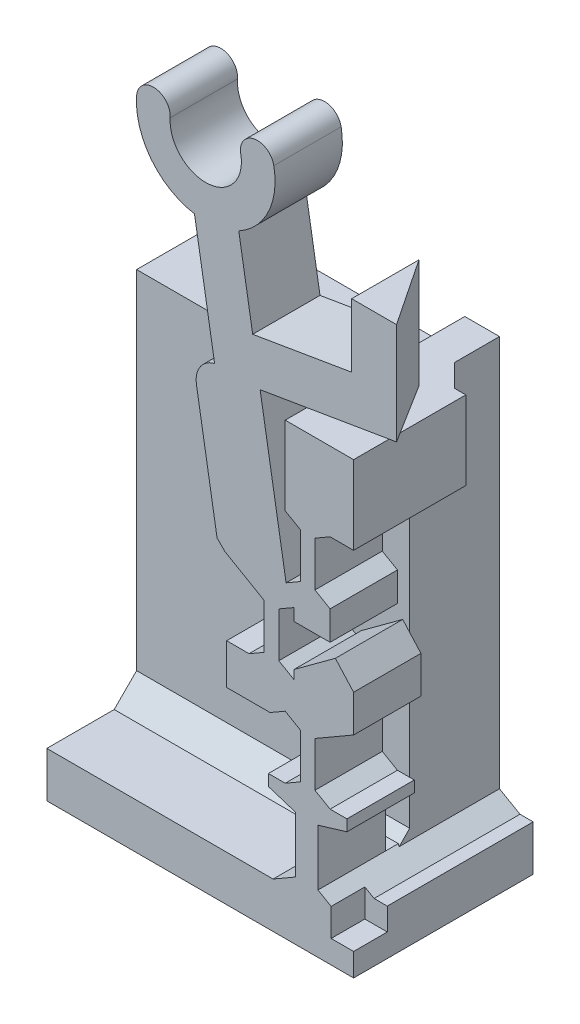
from build123d import *

# Parameters (mm, degrees)
BOSS_SWITCHMAIN_DEPTH                          = 3
SKETCH1_W                                      = 4
SKETCH1_H                                      = 3.5
BOSS_FLANGE_WIDTH_DEPTH                        = 5
BOSS_FLANGE_HEIGHT_REACH                       = 38.958
SKETCH2_W                                      = 4
SKETCH2_H                                      = 2
SKETCH2_W_2                                    = 8
SKETCH2_H_2                                    = 2.024994097
CUT_UP_TO_DOWN_DERAILLEUR_CLEARANCE_REACH      = 27.678
SKETCH10_W                                     = 2.453096586
SKETCH10_H                                     = 3
SKETCH17_W                                     = 12.1675
SKETCH17_H                                     = 4
BOSS_FLANGE_SUPPORT_DEPTH                      = 14.475002167
TAP_DRILL_FOR_M2X0_4_TAP1_D                    = 1.6
M2_CLEARANCE_HOLE2_D                           = 2.4
M2_CLEARANCE_HOLE2_DEPTH                       = 15
M2_CLEARANCE_HOLE2_TIP                         = 0.721032743
CUT_UP_TO_DOWN_CANTILEVER_SLOPE_REACH          = 32.725
CUT_DOWN_TO_UP_DERAILLEUR_CLEARANCE_DEPTH      = 34.178566414
CUT_DOWN_TO_UP_DERAILLEUR_CLEARANCE_DEPTH_BACK = 34.178566414
CHAMFER_FLANGE_SUPPORT_SIZE                    = 1.5
CHAMFER_FLANGE_SUPPORT_2_SIZE                  = 1
CHAMFER_FLANGE_SUPPORT_3_SIZE                  = 1
SKETCH18_W                                     = 1.5
SKETCH18_H                                     = 1.577350269
CUT_DOWN_TO_UP_DERAILLEUR_CLEARANCE_2_DEPTH    = 1


with BuildPart() as part:
    # Sketch-SwitchBossUp → Boss-SwitchMain (new body)
    with BuildSketch(Plane.XY):
        with BuildLine():
            Line((6.540476927, 22.165014537), (6.540476927, 25.000549624))
            Line((6.540476927, 25.000549624), (8.540476927, 25.000549624))
            Line((8.540476927, 25.000549624), (8.540476927, 20.473554675))
            Line((8.540476927, 20.473554675), (2.463355023, 19.450530066))
            Line((2.463355023, 19.450530066), (3.620297651, 12.577888564))
            Line((3.620297651, 12.577888564), (4.256080915, 12.944958203))
            Line((4.256080915, 12.944958203), (4.256080915, 14.944958203))
            Line((4.256080915, 14.944958203), (3.581073513, 15.334673908))
            Line((3.581073513, 15.334673908), (3.581073513, 18.834673908))
            Line((3.581073513, 18.834673908), (6.857327822, 18.834673908))
            Line((6.857327822, 18.834673908), (15.309115797, 18.834673908))
            Line((15.309115797, 18.834673908), (15.309115797, -1.165326092))
            Line((15.309115797, -1.165326092), (5.040476927, -1.165326092))
            Line((5.040476927, -1.165326092), (3.040476927, -1.165326092))
            Line((3.040476927, -1.165326092), (3.040476927, 0.859668005))
            Line((3.040476927, 0.859668005), (4.040476927, 1.437018274))
            Line((4.040476927, 1.437018274), (4.040476927, 3.937018274))
            Line((4.040476927, 3.937018274), (2.83114552, 4.326720436))
            Line((2.83114552, 4.326720436), (2.83114552, 4.826720436))
            Line((2.83114552, 4.826720436), (3.58114552, 4.826720436))
            Line((3.58114552, 4.826720436), (4.256138119, 5.216427595))
            Line((4.256138119, 5.216427595), (4.256138119, 7.216427595))
            Line((4.256138119, 7.216427595), (3.581130717, 7.6061433))
            Line((3.581130717, 7.6061433), (2.9061262, 7.216422599))
            Line((2.9061262, 7.216422599), (0.971281627, 7.216422599))
            Line((0.971281627, 7.216422599), (0.971281627, 9.019692757))
            Line((0.971281627, 9.019692757), (1.971281627, 9.019692757))
            Line((1.971281627, 9.019692757), (2.646271341, 9.40939825))
            Line((2.646271341, 9.40939825), (2.646271341, 11.40939825))
            Line((2.646271341, 11.40939825), (0.897326855, 12.41915182))
            Line((0.897326855, 12.41915182), (0.545466745, 12.771663724))
            Line((0.545466745, 12.771663724), (-0.372784255, 18.226393961))
            ThreePointArc((-0.372784255, 18.226393961), (-0.209313172, 18.996084896), (0.435897335, 19.446473985))
            Line((0.435897335, 19.446473985), (-0.46073685, 24.772792819))
            ThreePointArc((-0.46073685, 24.772792819), (-2.387846783, 25.912534906), (-3.038018253, 28.054973186))
            ThreePointArc((-3.038018253, 28.054973186), (-2.23296648, 28.745546602), (-1.542393064, 27.940494829))
            ThreePointArc((-1.542393064, 27.940494829), (0.129544452, 26.234339128), (1.59980805, 28.11706781))
            ThreePointArc((1.59980805, 28.11706781), (2.195840434, 28.994419163), (3.073191787, 28.398386779))
            ThreePointArc((3.073191787, 28.398386779), (2.830256228, 26.496543155), (1.511513111, 25.104801997))
            Line((1.511513111, 25.104801997), (2.131345845, 21.422780026))
            Line((2.131345845, 21.422780026), (6.540476927, 22.165014537))
        make_face()
        Polygon((5.581091201, 12.555245643), (5.581100766, 11.263016278), (3.971265023, 11.263016278), (3.97126394, 11.79911022), (3.296271341, 11.409403061), (3.296271341, 9.409403061), (3.971278743, 9.019687356), (3.971278743, 9.409408058), (5.815189335, 10.763016278), (6.627976927, 9.860324206), (6.627976927, 8.210536506), (5.581127833, 7.606137899), (4.906138119, 7.216432406), (4.906138119, 5.216432406), (5.58114552, 4.826716701), (6.33114552, 4.826716701), (6.33114552, 4.326716701), (5.040476927, 3.937018274), (5.040476927, 1.437018274), (6.040476927, 0.859668005), (9.127976927, 0.859668005), (10.437466736, 2.169157813), (10.437466736, 14.025180364), (9.127976927, 15.334670172), (5.581073513, 15.334670172), (4.906080915, 14.944963014), (4.906080915, 12.944963014), align=None, mode=Mode.SUBTRACT)
    extrude(amount=BOSS_SWITCHMAIN_DEPTH)

    # Sketch1 → Boss-Flange Width (add)
    with BuildSketch(Plane(origin=(0, 0, 0), x_dir=(-1, 0, 0), z_dir=(0, 0, -1))):
        Polygon((-7.581073513, -1.165326092), (0.412170615, -1.165326092), (0.412170615, 0.859668005), (-3.040476927, 0.859668005), (-4.040476927, 1.437018274), (-5.040476927, 1.437018274), (-6.040476927, 0.859668005), (-7.581073513, 0.859668005), align=None)
        with Locations((-5.581073513, 17.084673908)):
            Rectangle(SKETCH1_W, SKETCH1_H)
    extrude(amount=BOSS_FLANGE_WIDTH_DEPTH)

    # Sketch2 → Boss-Flange Height (add, up to next)
    with BuildSketch(Plane(origin=(-7.039523073, 0, 0), x_dir=(0, 0, -1), z_dir=(1, 0, 0)), mode=Mode.PRIVATE) as boss_flange_height_sk1:
        with Locations((3, 16.334673908)):
            Rectangle(SKETCH2_W, SKETCH2_H)
    boss_flange_height_tool1 = extrude(boss_flange_height_sk1.sketch, amount=BOSS_FLANGE_HEIGHT_REACH, mode=Mode.PRIVATE) - part.part
    # Sketch2 → Boss-Flange Height (add, up to next)
    with BuildSketch(Plane(origin=(-7.039523073, 0, 0), x_dir=(0, 0, -1), z_dir=(1, 0, 0)), mode=Mode.PRIVATE) as boss_flange_height_sk2:
        with Locations((1, -0.152829044)):
            Rectangle(SKETCH2_W_2, SKETCH2_H_2)
    boss_flange_height_tool2 = extrude(boss_flange_height_sk2.sketch, amount=BOSS_FLANGE_HEIGHT_REACH, mode=Mode.PRIVATE) - part.part
    add(boss_flange_height_tool1.solids().sort_by_distance((-7.039523, 16.334674, -3))[0])
    add(boss_flange_height_tool2.solids().sort_by_distance((-7.039523, -0.152829, -1))[0])

    # Sketch10 → Cut-Up-To-Down Derailleur Clearance (cut, up to next)
    with BuildSketch(Plane(origin=(0, 18.834673908, 0), x_dir=(1, 0, 0), z_dir=(0, 1, 0)), mode=Mode.PRIVATE) as cut_up_to_down_derailleur_clearance_sk1:
        with Locations((6.35452522, 3.5)):
            Rectangle(SKETCH10_W, SKETCH10_H)
    cut_up_to_down_derailleur_clearance_tool1 = extrude(cut_up_to_down_derailleur_clearance_sk1.sketch, amount=-CUT_UP_TO_DOWN_DERAILLEUR_CLEARANCE_REACH, mode=Mode.PRIVATE) & part.part
    add(cut_up_to_down_derailleur_clearance_tool1.solids().sort_by_distance((6.354525, 18.834674, -3.5))[0], mode=Mode.SUBTRACT)


with BuildPart() as boss_flange_support_tool:
    # Sketch17 → Boss-Flange Support (new body)
    with BuildSketch(Plane.XZ.offset(-15.334670172)):
        with Locations((-0.955773073, -3)):
            Rectangle(SKETCH17_W, SKETCH17_H)
    extrude(amount=BOSS_FLANGE_SUPPORT_DEPTH)


with BuildPart() as part_1:
    add(part.part)


with BuildPart() as part_2:
    # Boss-Flange Support: joined with boss_flange_support_tool
    add(part_1.part.fuse(boss_flange_support_tool.part, tol=0.00001))

    # Tap Drill for M2x0.4 Tap1 (through all)
    with Locations(Plane(origin=(0, -1.165326092, 0), x_dir=(-1, 0, 0), z_dir=(0, -1, 0))):
        with Locations((4.039523073, 3), (-0.581073513, 3)):
            Hole(TAP_DRILL_FOR_M2X0_4_TAP1_D / 2)

    # M2 Clearance Hole2
    with Locations(Plane.XZ.offset(1.165326092)):
        with Locations((-4.039523073, -3), (0.581073513, -3)):
            Hole(M2_CLEARANCE_HOLE2_D / 2, depth=M2_CLEARANCE_HOLE2_DEPTH)
            with Locations((0, 0, -(M2_CLEARANCE_HOLE2_DEPTH + M2_CLEARANCE_HOLE2_TIP / 2))):  # 118° drill point
                Cone(0, M2_CLEARANCE_HOLE2_D / 2, M2_CLEARANCE_HOLE2_TIP, mode=Mode.SUBTRACT)

    # Sketch12 → Cut-Up-to-Down Cantilever Slope (cut, up to next)
    with BuildSketch(Plane(origin=(0, 25.000549624, 0), x_dir=(1, 0, 0), z_dir=(0, 1, 0)), mode=Mode.PRIVATE) as cut_up_to_down_cantilever_slope_sk1:
        Polygon((6.540476927, 0), (8.540476927, -3), (8.540476927, 0), align=None)
    cut_up_to_down_cantilever_slope_tool1 = extrude(cut_up_to_down_cantilever_slope_sk1.sketch, amount=-CUT_UP_TO_DOWN_CANTILEVER_SLOPE_REACH, mode=Mode.PRIVATE) & part_2.part
    add(cut_up_to_down_cantilever_slope_tool1.solids().sort_by_distance((7.87381, 25.00055, 1))[0], mode=Mode.SUBTRACT)

    # Sketch16 → Cut-Down-to-Up Derailleur Clearance (cut, two sides: drawn at the far end of the back side and taken through both)
    with BuildSketch(Plane(origin=(0, 0, 0), x_dir=(-1, 0, 0), z_dir=(0, 0, -1)).offset(-CUT_DOWN_TO_UP_DERAILLEUR_CLEARANCE_DEPTH_BACK)):
        Polygon((-6.627976927, 18.834673908), (-15.309115797, 18.834673908), (-15.309115797, -1.165326092), (-6.627976927, -1.165326092), (-6.627976927, 5.203794929), (-8.003689255, 5.203794929), (-8.003689255, 12.048417413), (-6.627976927, 12.048417413), align=None)
    extrude(amount=CUT_DOWN_TO_UP_DERAILLEUR_CLEARANCE_DEPTH + CUT_DOWN_TO_UP_DERAILLEUR_CLEARANCE_DEPTH_BACK, mode=Mode.SUBTRACT)

    # Chamfer-Flange Support
    chamfer_flange_support_edges = [part_2.edges().sort_by_distance(p)[0] for p in [
        (3.581073513, 17.334673908, -3),
    ]]
    chamfer(chamfer_flange_support_edges, length=CHAMFER_FLANGE_SUPPORT_SIZE - 0.0001)  # a hair under: the kernel refuses the full size

    # Chamfer-Flange Support 2
    chamfer_flange_support_2_edges = [part_2.edges().sort_by_distance(p)[0] for p in [
        (5.127976927, 17.084673908, -2),
        (5.127976927, 15.334670172, -1.5),
    ]]
    chamfer(chamfer_flange_support_2_edges, length=CHAMFER_FLANGE_SUPPORT_2_SIZE)

    # Chamfer-Flange Support 3
    chamfer_flange_support_3_edges = [part_2.edges().sort_by_distance(p)[0] for p in [
        (-1.999523073, 0.859668005, -1),
    ]]
    chamfer(chamfer_flange_support_3_edges, length=CHAMFER_FLANGE_SUPPORT_3_SIZE)

    # Sketch18 → Cut-Down-to-Up Derailleur Clearance 2 (cut)
    with BuildSketch(Plane(origin=(6.627976927, 0, 0), x_dir=(0, 0, -1), z_dir=(1, 0, 0))):
        with Locations((-2.25, 0.64834314)):
            Rectangle(SKETCH18_W, SKETCH18_H)
    extrude(amount=-CUT_DOWN_TO_UP_DERAILLEUR_CLEARANCE_2_DEPTH, mode=Mode.SUBTRACT)


solid = part_2.part
